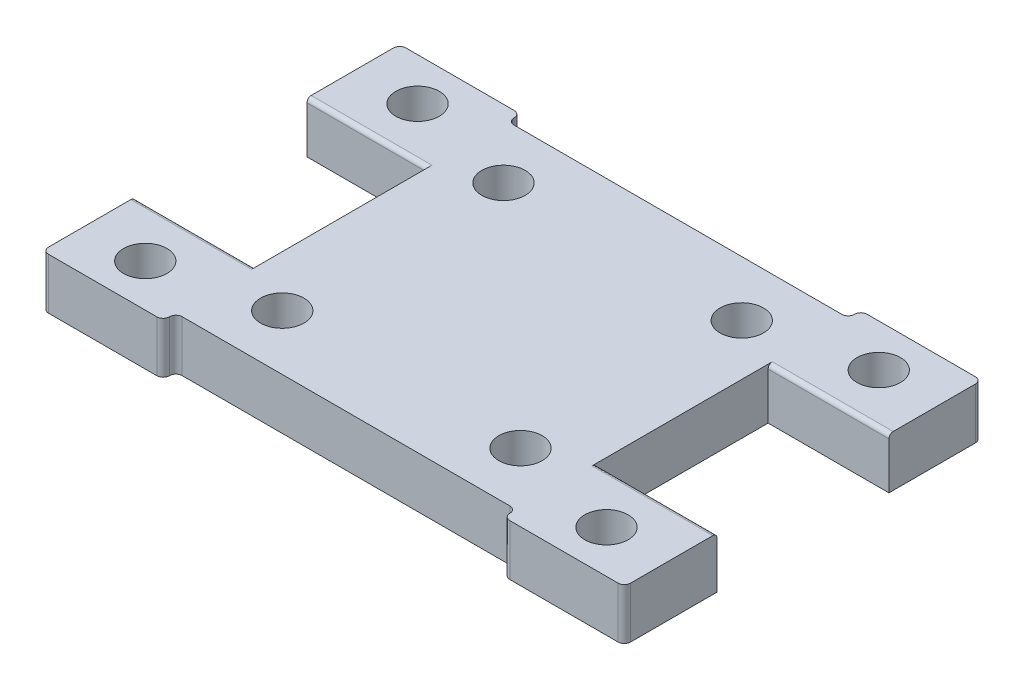
from build123d import *

# Parameters (mm, degrees)
SKETCH1_R           = 2.55
BOSS_EXTRUDE1_DEPTH = 6
FILLET1_R           = 0.74
FILLET2_R           = 0.5


with BuildPart() as part:
    # Sketch1 → Boss-Extrude1 (new body)
    with BuildSketch(Plane(origin=(0, 0, 0), x_dir=(1, 0, 0), z_dir=(0, 1, 0))):
        with BuildLine():
            Line((-19.26, -19.5), (19.26, -19.5))
            ThreePointArc((19.26, -19.5), (19.783259018, -19.716740982), (20, -20.24))
            Line((20, -20.24), (20, -20.26))
            ThreePointArc((20, -20.26), (20.216740982, -20.783259018), (20.74, -21))
            Line((20.74, -21), (34.2, -21))
            Line((34.2, -21), (34.2, -10.1))
            Line((34.2, -10.1), (20, -10.1))
            Line((20, -10.1), (20, 10.1))
            Line((20, 10.1), (34.2, 10.1))
            Line((34.2, 10.1), (34.2, 21))
            Line((34.2, 21), (20.74, 21))
            ThreePointArc((20.74, 21), (20.216740982, 20.783259018), (20, 20.26))
            Line((20, 20.26), (20, 20.24))
            ThreePointArc((20, 20.24), (19.783259018, 19.716740982), (19.26, 19.5))
            Line((19.26, 19.5), (-19.26, 19.5))
            ThreePointArc((-19.26, 19.5), (-19.783259018, 19.716740982), (-20, 20.24))
            Line((-20, 20.24), (-20, 20.26))
            ThreePointArc((-20, 20.26), (-20.216740982, 20.783259018), (-20.74, 21))
            Line((-20.74, 21), (-34.2, 21))
            Line((-34.2, 21), (-34.2, 10.1))
            Line((-34.2, 10.1), (-20, 10.1))
            Line((-20, 10.1), (-20, -10.1))
            Line((-20, -10.1), (-34.2, -10.1))
            Line((-34.2, -10.1), (-34.2, -21))
            Line((-34.2, -21), (-20.74, -21))
            ThreePointArc((-20.74, -21), (-20.216740982, -20.783259018), (-20, -20.26))
            Line((-20, -20.26), (-20, -20.24))
            ThreePointArc((-20, -20.24), (-19.783259018, -19.716740982), (-19.26, -19.5))
        make_face()
        with Locations((-14, 13)):
            Circle(SKETCH1_R, mode=Mode.SUBTRACT)
        with Locations((14, 13)):
            Circle(SKETCH1_R, mode=Mode.SUBTRACT)
        with Locations((14, -13)):
            Circle(SKETCH1_R, mode=Mode.SUBTRACT)
        with Locations((-14, -13)):
            Circle(SKETCH1_R, mode=Mode.SUBTRACT)
        with Locations((27.1, 16)):
            Circle(SKETCH1_R, mode=Mode.SUBTRACT)
        with Locations((27.1, -16)):
            Circle(SKETCH1_R, mode=Mode.SUBTRACT)
        with Locations((-27.1, -16)):
            Circle(SKETCH1_R, mode=Mode.SUBTRACT)
        with Locations((-27.1, 16)):
            Circle(SKETCH1_R, mode=Mode.SUBTRACT)
    extrude(amount=BOSS_EXTRUDE1_DEPTH)

    # Fillet1
    fillet1_edges = [part.edges().sort_by_distance(p)[0] for p in [
        (-34.2, 3, -21),
        (-34.2, 3, 21),
        (34.2, 3, 21),
        (34.2, 3, -21),
    ]]
    fillet(fillet1_edges, radius=FILLET1_R)

    # Fillet2
    fillet2_edges = [part.edges().sort_by_distance(p)[0] for p in [
        (-27.1, 6, -10.1),
        (-27.1, 6, 10.1),
        (27.1, 6, -10.1),
        (27.1, 6, 10.1),
    ]]
    fillet(fillet2_edges, radius=FILLET2_R)


solid = part.part
